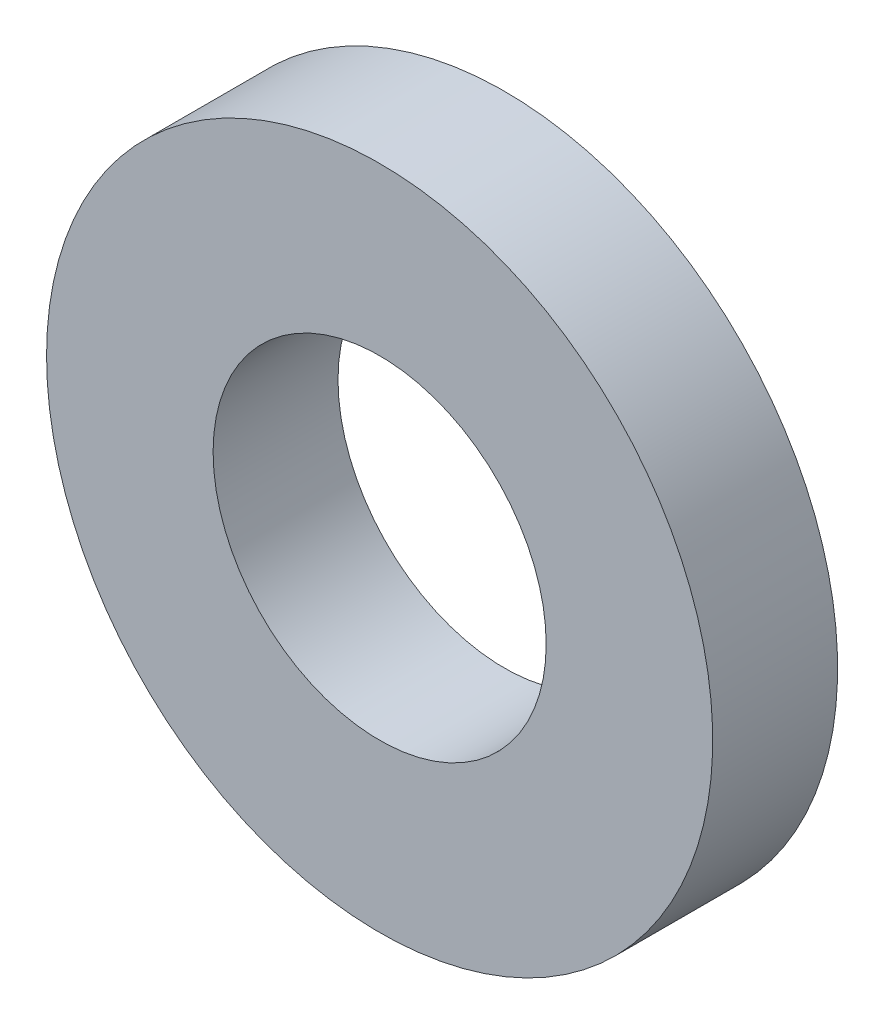
from build123d import *

# Parameters (mm, degrees)
SKETCH1_R           = 12.7
SKETCH1_R_2         = 6.35
BOSS_EXTRUDE1_DEPTH = 2.38125


with BuildPart() as part:
    # Sketch1 → Boss-Extrude1 (new, symmetric)
    with BuildSketch(Plane.XY):
        Circle(SKETCH1_R)
        Circle(SKETCH1_R_2, mode=Mode.SUBTRACT)
    extrude(amount=BOSS_EXTRUDE1_DEPTH, both=True)


solid = part.part
